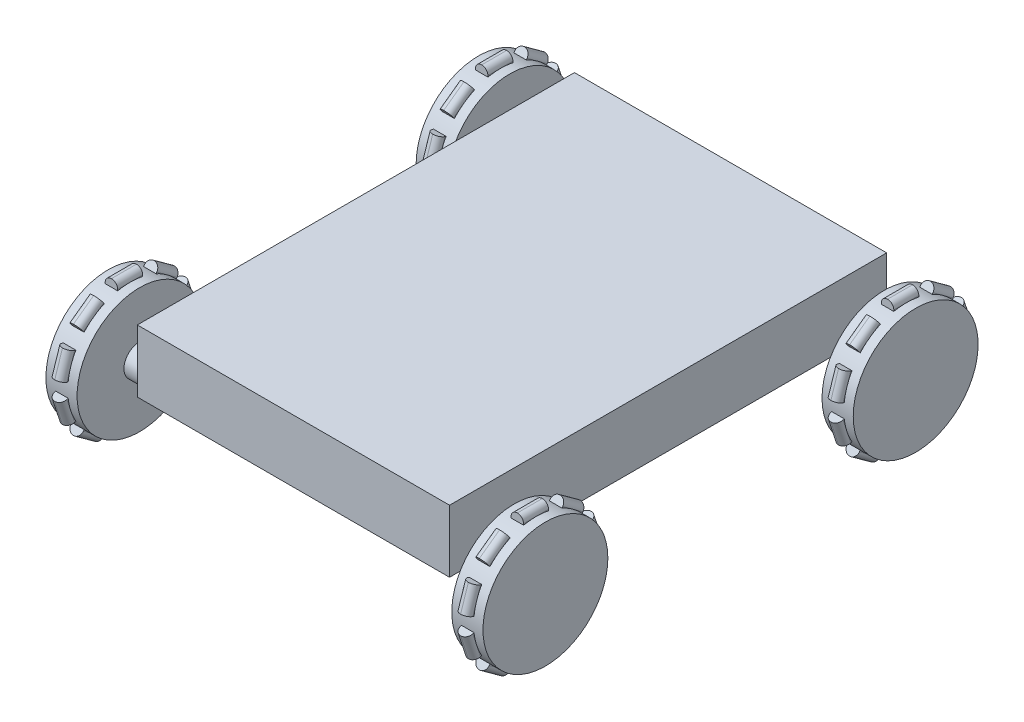
from build123d import *

# Parameters (mm, degrees)
CROQUIS2_W              = 50
CROQUIS2_H              = 70
SALIENTE_EXTRUIR1_DEPTH = 10
CROQUIS4_R              = 2.5
SALIENTE_EXTRUIR2_DEPTH = 30
CROQUIS5_R              = 10
SALIENTE_EXTRUIR3_DEPTH = 5
CROQUIS6_W              = 4
CROQUIS6_H              = 2
SALIENTE_EXTRUIR4_DEPTH = 1
REDONDEO1_R             = 1
MATRIZC1_COUNT          = 10
REDONDEO1_OF_MATRIZC1_R = 1


# Read off the part's stored shape, not the designer's step: Simetría4, Simetría5
with BuildPart() as part:
    # Croquis2 → Saliente-Extruir1 (new body)
    with BuildSketch(Plane(origin=(0, 0, 0), x_dir=(1, 0, 0), z_dir=(0, 1, 0))):
        Rectangle(CROQUIS2_W, CROQUIS2_H)
    extrude(amount=SALIENTE_EXTRUIR1_DEPTH)

    # Croquis4 → Saliente-Extruir2 (add, symmetric)
    with BuildSketch(Plane(origin=(0, 0, 0), x_dir=(0, 0, -1), z_dir=(1, 0, 0))):
        with Locations((-29.646809276, 0)):
            Circle(CROQUIS4_R)
    saliente_extruir2 = extrude(amount=SALIENTE_EXTRUIR2_DEPTH, both=True)

    # Croquis5 → Saliente-Extruir3 (add)
    with BuildSketch(Plane(origin=(30, 0, 0), x_dir=(0, 0, -1), z_dir=(1, 0, 0))):
        with Locations((-29.646809276, 0)):
            Circle(CROQUIS5_R)
    extrude(amount=SALIENTE_EXTRUIR3_DEPTH)

    # Simetría2: Saliente-Extruir2 across plane
    add(saliente_extruir2.mirror(Plane.XY))

    # Croquis6 → Saliente-Extruir4 (add, symmetric)
    with BuildSketch(Plane(origin=(32.5, 0, 0), x_dir=(0, 0, -1), z_dir=(1, 0, 0))):
        with Locations((-29.646809276, 10)):
            Rectangle(CROQUIS6_W, CROQUIS6_H)
    saliente_extruir4 = extrude(amount=SALIENTE_EXTRUIR4_DEPTH, both=True)

    # Redondeo1
    redondeo1_edges = [part.edges().sort_by_distance(p)[0] for p in [
        (31.5, 11, 29.646809276),
        (33.5, 11, 29.646809276),
    ]]
    fillet(redondeo1_edges, radius=REDONDEO1_R - 0.0001)  # a hair under: the kernel refuses the full size

    # MatrizC1: Saliente-Extruir4 ×10 about axis
    matrizc1_axis = Axis((0, 0, 29.646809276), (1, 0, 0))
    for i in range(1, MATRIZC1_COUNT):
        add(saliente_extruir4.rotate(matrizc1_axis, i * 360 / MATRIZC1_COUNT))

    # Redondeo1 of MatrizC1
    redondeo1_of_matrizc1_edges = [part.edges().sort_by_distance(p)[0] for p in [
        (31.5, 8.899186938, 36.112447051),
        (33.5, 8.899186938, 36.112447051),
        (31.5, 3.399186938, 40.108430955),
        (33.5, 3.399186938, 40.108430955),
        (31.5, -3.399186938, 40.108430955),
        (33.5, -3.399186938, 40.108430955),
        (31.5, -8.899186938, 36.112447051),
        (33.5, -8.899186938, 36.112447051),
        (31.5, -11, 29.646809276),
        (33.5, -11, 29.646809276),
        (31.5, -8.899186938, 23.181171501),
        (33.5, -8.899186938, 23.181171501),
        (31.5, -3.399186938, 19.185187597),
        (33.5, -3.399186938, 19.185187597),
        (31.5, 3.399186938, 19.185187597),
        (33.5, 3.399186938, 19.185187597),
        (31.5, 8.899186938, 23.181171501),
        (33.5, 8.899186938, 23.181171501),
    ]]
    fillet(redondeo1_of_matrizc1_edges, radius=REDONDEO1_OF_MATRIZC1_R - 0.0001)  # a hair under: the kernel refuses the full size

    # Simetría4: part across plane


with BuildPart() as part_1:
    add(part.part)
    add(part.part.mirror(Plane(origin=(0, 0, 0), x_dir=(0, 0, 1), z_dir=(1, 0, 0))))

    # Simetría5: part across plane


with BuildPart() as part_2:
    add(part_1.part)
    add(part_1.part.mirror(Plane.XY))


solid = part_2.part
